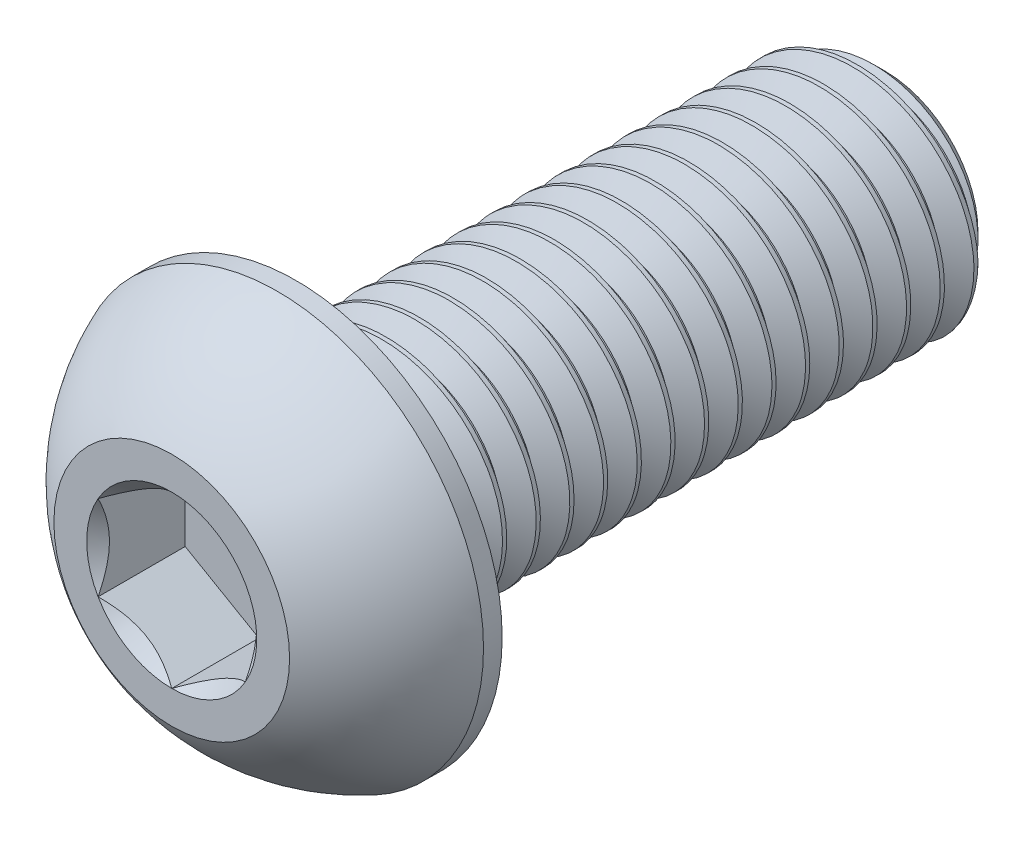
from build123d import *

# Parameters (mm, degrees)
SKETCH1_W          = 15.875
SKETCH1_H          = 3.175
CHAMFER1_SIZE      = 0.680357143
CUT_SWEEP1_PITCH   = 0.907142857
CUT_EXTRUDE2_DEPTH = 2.34696


with BuildPart() as part:
    # Sketch1 → Revolve1 (revolve)
    with BuildSketch(Plane(origin=(0, 0, 0), x_dir=(0, 0, -1), z_dir=(1, 0, 0))):
        with Locations((11.2903, 1.5875)):
            Rectangle(SKETCH1_W, SKETCH1_H)
    revolve(axis=Axis((0, 0, -19.2278), (0, 0, 1)))

    # Chamfer1
    chamfer1_edges = [part.edges().sort_by_distance(p)[0] for p in [
        (0, -3.175, -19.2278),
    ]]
    chamfer(chamfer1_edges, length=CHAMFER1_SIZE)

    # Cut-Sweep1: the profile of Sketch2 profile screwed along a right-hand helix of 18.5 turns, 8 arcs to a turn; built about Z, then put on its axis
    cut_sweep1_z = Axis((0, 0, 0), (0, 0, 1))
    cut_sweep1_corners = [(3.1753, 0, 0.000173205), (3.1753, 0, -0.793923205), (2.585793431, 0, -0.453571429), (2.585793431, 0, -0.340178571)]
    with BuildLine(mode=Mode.PRIVATE) as cut_sweep1_profile:
        Line(cut_sweep1_corners[0], cut_sweep1_corners[1])
        Line(cut_sweep1_corners[1], cut_sweep1_corners[2])
        Line(cut_sweep1_corners[2], cut_sweep1_corners[3])
        Line(cut_sweep1_corners[3], cut_sweep1_corners[0])
    cut_sweep1_cap = Face(cut_sweep1_profile.wire())
    cut_sweep1_turn_angles = [0, 22.5, 45, 67.5, 90, 112.5, 135, 157.5, 180, 202.5, 225, 247.5, 270, 292.5, 315, 337.5, 360]
    cut_sweep1_turn_weights = [1, 0.9238795325112867, 1, 0.9238795325112867, 1, 0.9238795325112867, 1, 0.9238795325112867, 1, 0.9238795325112867, 1, 0.9238795325112867, 1, 0.9238795325112867, 1, 0.9238795325112867, 1]
    cut_sweep1_turn_rails = [Edge.make_bspline([Vector(p[0], p[1], 0).rotate(cut_sweep1_z, cut_sweep1_turn_angles[k]) / cut_sweep1_turn_weights[k] + Vector(0, 0, p[2] + CUT_SWEEP1_PITCH * cut_sweep1_turn_angles[k] / 360) for k in range(17)], [0, 0, 0, 1, 1, 2, 2, 3, 3, 4, 4, 5, 5, 6, 6, 7, 7, 8, 8, 8], 2, cut_sweep1_turn_weights) for p in cut_sweep1_corners]
    cut_sweep1_turn_sides = [Face.make_surface_from_curves(cut_sweep1_turn_rails[p[0]], cut_sweep1_turn_rails[p[1]]) for p in [(0, 1), (1, 2), (2, 3), (3, 0)]]
    cut_sweep1_last_angles = [6480, 6502.5, 6525, 6547.5, 6570, 6592.5, 6615, 6637.5, 6660]
    cut_sweep1_last_weights = [1, 0.9238795325112867, 1, 0.9238795325112867, 1, 0.9238795325112867, 1, 0.9238795325112047, 1]
    cut_sweep1_last_rails = [Edge.make_bspline([Vector(p[0], p[1], 0).rotate(cut_sweep1_z, cut_sweep1_last_angles[k]) / cut_sweep1_last_weights[k] + Vector(0, 0, p[2] + CUT_SWEEP1_PITCH * cut_sweep1_last_angles[k] / 360) for k in range(9)], [0, 0, 0, 1, 1, 2, 2, 3, 3, 4, 4, 4], 2, cut_sweep1_last_weights) for p in cut_sweep1_corners]
    cut_sweep1_last_sides = [Face.make_surface_from_curves(cut_sweep1_last_rails[p[0]], cut_sweep1_last_rails[p[1]]) for p in [(0, 1), (1, 2), (2, 3), (3, 0)]]
    cut_sweep1 = Plane(origin=(0, 0, -19.2278), x_dir=(0, 1, 0), z_dir=(0, 0, 1)) * Solid(Shell([*[p.moved(Location((0, 0, CUT_SWEEP1_PITCH * i))) for i in range(18) for p in cut_sweep1_turn_sides], *cut_sweep1_last_sides, cut_sweep1_cap, cut_sweep1_cap.rotate(cut_sweep1_z, 6660).moved(Location((0, 0, CUT_SWEEP1_PITCH * 6660 / 360)))]))
    add(cut_sweep1, mode=Mode.SUBTRACT)

    # Sketch7 → Revolve2 (revolve)
    with BuildSketch(Plane(origin=(0, 0, 0), x_dir=(0, 0, -1), z_dir=(1, 0, 0)), mode=Mode.PRIVATE) as revolve2_sk:
        with BuildLine():
            Line((2.84988, 5.5499), (3.3528, 5.5499))
            Line((3.3528, 5.5499), (3.3528, 0))
            Line((3.3528, 0), (0, 0))
            Line((0, 0), (0, 3.175))
            ThreePointArc((0, 3.175), (1.235921075, 4.58927271), (2.84988, 5.5499))
        make_face()
    revolve(revolve2_sk.sketch.rotate(Axis((0, 0, 0), (0, 0, -1)), 189.052465709), axis=Axis((0, 0, 0), (0, 0, -1)))

    # Sketch5 → Cut-Extrude2 (cut)
    with BuildSketch(Plane.XY):
        Polygon((1.984375, -1.14567944), (1.984375, 1.14567944), (0, 2.291358881), (-1.984375, 1.14567944), (-1.984375, -1.14567944), (0, -2.291358881), align=None)
    extrude(amount=-CUT_EXTRUDE2_DEPTH, mode=Mode.SUBTRACT)

    # Cut-Extrude3 cone 1 section (through the dimple's axis) → Cut-Extrude3 (revolve, cut)
    with BuildSketch(Plane(origin=(0, 0, 0), x_dir=(0, -1, 0), z_dir=(1, 0, 0))):
        Polygon((0, 0), (2.291358881, 0), (0, 2.291358881), align=None)
    revolve(axis=Axis((0, 0, 0), (0, 0, -1)), mode=Mode.SUBTRACT)


solid = part.part
